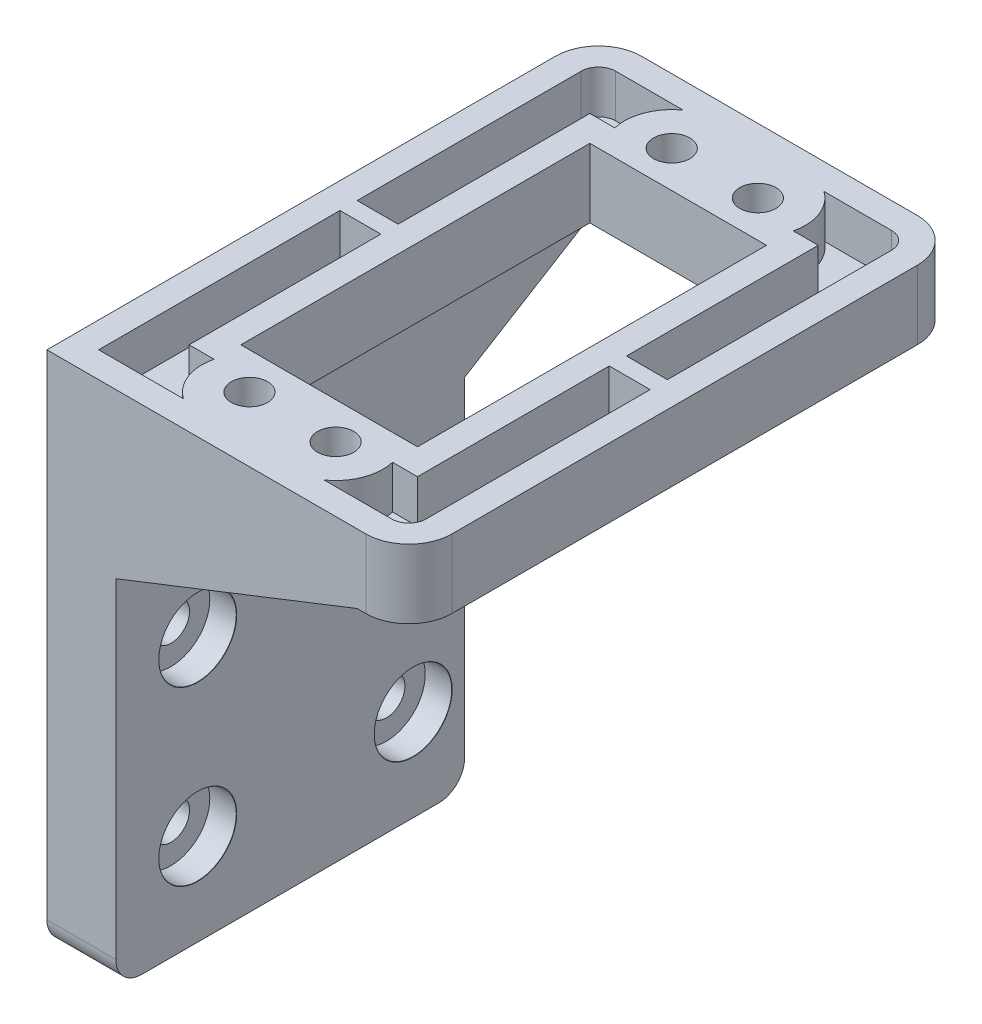
from build123d import *

# Parameters (mm, degrees)
SKETCH1_W                                     = 34.925
SKETCH1_H                                     = 49.276
BOSS_EXTRUDE1_DEPTH                           = 8
SKETCH2_W                                     = 42
SKETCH2_H                                     = 8
BOSS_EXTRUDE2_DEPTH                           = 34.925
CBORE_FOR_M4_PAN_HEAD_MACHINE_SCREW1_AT_COUNT = 2
CBORE_FOR_M4_PAN_HEAD_MACHINE_SCREW1_AT_PITCH = 25.000000038
CBORE_FOR_M4_PAN_HEAD_MACHINE_SCREW1_2_COUNT  = 2
CBORE_FOR_M4_PAN_HEAD_MACHINE_SCREW1_2_PITCH  = 32.015620982
CBORE_FOR_M4_PAN_HEAD_MACHINE_SCREW1_3_COUNT  = 2
CBORE_FOR_M4_PAN_HEAD_MACHINE_SCREW1_3_PITCH  = 19.999999624
SKETCH5_R                                     = 9
CUT_EXTRUDE1_DEPTH                            = 21
CUT_EXTRUDE2_START                            = -1
SKETCH5_4_R                                   = 11
CUT_EXTRUDE2_DEPTH                            = 7
FILLET1_R                                     = 17
SKETCH7_W                                     = 42
SKETCH7_H                                     = 64
BOSS_EXTRUDE3_DEPTH                           = 8
SKETCH8_R                                     = 2.5
CUT_EXTRUDE3_DEPTH                            = 252.336701124
MOVE_FACE1_OUTLINE_W                          = 8
MOVE_FACE1_OUTLINE_H                          = 4.5375
MOVE_FACE1_DEPTH                              = 41.276
SKETCH9_W                                     = 20.5
SKETCH9_H                                     = 40.5
CUT_EXTRUDE4_DEPTH                            = 250.891419084
MOVE_FACE2_BY                                 = 11
MOVE_START                                    = -24.5375
MOVE_FACE3_OUTLINE_W                          = 34
MOVE_FACE3_OUTLINE_H                          = 11
MOVE_FACE3_DEPTH                              = 64
MOVE_FACE3_2_OUTLINE_W                        = 8
MOVE_FACE3_2_OUTLINE_H                        = 11
MOVE_FACE3_2_DEPTH                            = 24.5375
FILLET2_R                                     = 5
SPLIT1_SURFACE_1_BACK                         = 98.433
SPLIT1_SURFACE_1_DEPTH                        = 196.866
SPLIT1_SURFACE_2_BACK                         = 98.433
SPLIT1_SURFACE_2_DEPTH                        = 196.866
SHELL2_START                                  = 55.276
SHELL2_DEPTH                                  = 5
SKETCH11_W                                    = 33.4625
SKETCH11_H                                    = 15.638000188
CUT_EXTRUDE5_DEPTH                            = 4
RIB1_REACH                                    = 85.394
SKETCH12_WALLS_W                              = 2
SKETCH12_WALLS_H                              = 184.425110988
MOVE_START_2                                  = 55.276
MOVE_FACE4_DEPTH                              = 5
RIB2_REACH                                    = 255.723
SKETCH13_WALLS_W                              = 514.195403297
SKETCH13_WALLS_H                              = 2
MOVE_FACE5_BY                                 = 1
FILLET3_R                                     = 3
RIB4_REACH                                    = 260.677
SKETCH14_WALL_W                               = 549.437720842
SKETCH14_WALL_H                               = 3
BOSS_EXTRUDE4_DEPTH                           = 8
MOVE_FACE6_BY                                 = 0.4
MOVE_FACE6_2_BY                               = 0.4
MOVE_FACE6_3_BY                               = 0.4
MOVE_FACE6_4_BY                               = 0.4


# Read off the part's stored shape, not the designer's step: Move Face1, Move Face3, Shell2, Move Face4
with BuildPart() as part:
    # Sketch1 → Boss-Extrude1 (new body)
    with BuildSketch(Plane(origin=(201.279107713, 0, 0), x_dir=(0, 0, -1), z_dir=(1, 0, 0))):
        with Locations((-17.4625, 24.638)):
            Rectangle(SKETCH1_W, SKETCH1_H)
    extrude(amount=BOSS_EXTRUDE1_DEPTH)

    # Sketch2 → Boss-Extrude2 (add)
    with BuildSketch(Plane(origin=(0, 0, 0), x_dir=(-1, 0, 0), z_dir=(0, 0, -1))):
        with Locations((-222.279107713, 45.276)):
            Rectangle(SKETCH2_W, SKETCH2_H)
    extrude(amount=-BOSS_EXTRUDE2_DEPTH)

    # Sketch3 → CBORE for M4 Pan Head Machine Screw1 (revolve, cut)
    with BuildSketch(Plane(origin=(209.279107713, 30.637999812, 4.962499981), x_dir=(0, 0, -1), z_dir=(0, 1, 0))):
        Polygon((0, 0), (0, 8), (2.15, 8), (2.15, 3.1), (4.5, 3.1), (4.5, 0.025), (4.525, 0), align=None)
    cbore_for_m4_pan_head_machine_screw1 = revolve(axis=Axis((215.629107713, 30.637999812, 4.962499981), (-1, 0, 0)), mode=Mode.SUBTRACT)

    # CBORE for M4 Pan Head Machine Screw1 at: CBORE for M4 Pan Head Machine Screw1 ×2
    with Locations(*[(0, 0, i * CBORE_FOR_M4_PAN_HEAD_MACHINE_SCREW1_AT_PITCH) for i in range(1, CBORE_FOR_M4_PAN_HEAD_MACHINE_SCREW1_AT_COUNT)]):
        add(cbore_for_m4_pan_head_machine_screw1, mode=Mode.SUBTRACT)

    # CBORE for M4 Pan Head Machine Screw1 2: CBORE for M4 Pan Head Machine Screw1 ×2
    with Locations(*[Vector(0, -0.624695039814301, 0.780868815635129) * (i * CBORE_FOR_M4_PAN_HEAD_MACHINE_SCREW1_2_PITCH) for i in range(1, CBORE_FOR_M4_PAN_HEAD_MACHINE_SCREW1_2_COUNT)]):
        add(cbore_for_m4_pan_head_machine_screw1, mode=Mode.SUBTRACT)

    # CBORE for M4 Pan Head Machine Screw1 3: CBORE for M4 Pan Head Machine Screw1 ×2
    with Locations(*[(0, -i * CBORE_FOR_M4_PAN_HEAD_MACHINE_SCREW1_3_PITCH, 0) for i in range(1, CBORE_FOR_M4_PAN_HEAD_MACHINE_SCREW1_3_COUNT)]):
        add(cbore_for_m4_pan_head_machine_screw1, mode=Mode.SUBTRACT)

    # Sketch5 → Cut-Extrude1 (cut)
    with BuildSketch(Plane(origin=(0, 49.276, 0), x_dir=(1, 0, 0), z_dir=(0, 1, 0))):
        with Locations(Location((222.279107713, -17.4625, 0), (0, 0, 180))):
            Circle(SKETCH5_R)
    extrude(amount=-CUT_EXTRUDE1_DEPTH, mode=Mode.SUBTRACT)

    # Sketch5<4> → Cut-Extrude2 (cut)
    with BuildSketch(Plane(origin=(0, 49.276, 0), x_dir=(1, 0, 0), z_dir=(0, 1, 0)).offset(CUT_EXTRUDE2_START)):
        with Locations(Location((222.279107713, -17.4625, 0), (0, 0, 180))):
            Circle(SKETCH5_4_R)
    extrude(amount=-CUT_EXTRUDE2_DEPTH, mode=Mode.SUBTRACT)

    # Fillet1
    fillet1_edges = [part.edges().sort_by_distance(p)[0] for p in [
        (243.279107713, 45.276, 34.925),
        (243.279107713, 45.276, 0),
    ]]
    fillet(fillet1_edges, radius=FILLET1_R)

    # Sketch7 → Boss-Extrude3 (add)
    with BuildSketch(Plane(origin=(0, 49.276, 0), x_dir=(1, 0, 0), z_dir=(0, 1, 0))):
        with Locations((222.279107713, -7.4625)):
            Rectangle(SKETCH7_W, SKETCH7_H)
    extrude(amount=-BOSS_EXTRUDE3_DEPTH)

    # Sketch8 → Cut-Extrude3 (cut, through all)
    with BuildSketch(Plane(origin=(0, 49.276, 0), x_dir=(1, 0, 0), z_dir=(0, 1, 0))):
        with Locations(Location((217.279107713, -31.9625, 0), (0, 0, 180))):
            Circle(SKETCH8_R)
        with Locations(Location((227.279107713, -31.9625, 0), (0, 0, 180))):
            Circle(SKETCH8_R)
        with Locations(Location((227.279107713, 17.0375, 0), (0, 0, 180))):
            Circle(SKETCH8_R)
        with Locations(Location((217.279107713, 17.0375, 0), (0, 0, 180))):
            Circle(SKETCH8_R)
    extrude(amount=-CUT_EXTRUDE3_DEPTH, mode=Mode.SUBTRACT)

    # Move Face1 outline → Move Face1 (add)
    with BuildSketch(Plane(origin=(0, 0, 0), x_dir=(1, 0, 0), z_dir=(0, 1, 0))):
        with Locations((205.279107713, -37.19375)):
            Rectangle(MOVE_FACE1_OUTLINE_W, MOVE_FACE1_OUTLINE_H)
    extrude(amount=MOVE_FACE1_DEPTH)

    # Sketch9 → Cut-Extrude4 (cut, through all)
    with BuildSketch(Plane.XZ.offset(-41.276)):
        with Locations((222.279107713, 7.4625)):
            Rectangle(SKETCH9_W, SKETCH9_H)
    extrude(amount=-CUT_EXTRUDE4_DEPTH, mode=Mode.SUBTRACT)

    # Move Face2: a face moved outward by 11.0
    extrude(part.faces().sort_by_distance((232.779107713, 49.276, 7.4625))[0], amount=MOVE_FACE2_BY, dir=(0, 1, 0))

    # Move Face3 outline → Move Face3 (cut)
    with BuildSketch(Plane.XY.offset(MOVE_START)):
        with Locations((226.279107713, 46.776)):
            Rectangle(MOVE_FACE3_OUTLINE_W, MOVE_FACE3_OUTLINE_H)
    extrude(amount=MOVE_FACE3_DEPTH, mode=Mode.SUBTRACT)

    # Move Face3 2 outline → Move Face3 2 (cut)
    with BuildSketch(Plane.XY.offset(MOVE_START)):
        with Locations((205.279107713, 46.776)):
            Rectangle(MOVE_FACE3_2_OUTLINE_W, MOVE_FACE3_2_OUTLINE_H)
    extrude(amount=MOVE_FACE3_2_DEPTH, mode=Mode.SUBTRACT)

    # Fillet2
    fillet2_edges = [part.edges().sort_by_distance(p)[0] for p in [
        (243.279107713, 56.276, 39.4625),
        (243.279107713, 56.276, -24.5375),
        (201.279107713, 56.276, -24.5375),
    ]]
    fillet(fillet2_edges, radius=FILLET2_R)


with BuildPart() as body_2:
    # Split1: the piece behind the surface
    add(part.part)
    # Split1 surface: a surface, the sketch's curves swept straight by 196.866 mm
    with BuildLine(Plane.ZY.offset(-201.279107713).offset(-SPLIT1_SURFACE_1_BACK), mode=Mode.PRIVATE) as split1_surface_1_path:
        Line((-9.008584857, 52.276), (46.481380633, 52.276))
    split1_surface_1 = Shell.extrude(split1_surface_1_path.wire(), (-1 * SPLIT1_SURFACE_1_DEPTH, 0 * SPLIT1_SURFACE_1_DEPTH, 0 * SPLIT1_SURFACE_1_DEPTH))
    split(bisect_by=split1_surface_1, keep=Keep.BOTTOM)


with BuildPart() as part_1:
    add(part.part)

    # Split1: split by a surface, the side it looks to stays
    # Split1 surface: a surface, the sketch's curves swept straight by 196.866 mm
    with BuildLine(Plane.ZY.offset(-201.279107713).offset(-SPLIT1_SURFACE_2_BACK), mode=Mode.PRIVATE) as split1_surface_2_path:
        Line((-9.008584857, 52.276), (46.481380633, 52.276))
    split1_surface_2 = Shell.extrude(split1_surface_2_path.wire(), (-1 * SPLIT1_SURFACE_2_DEPTH, 0 * SPLIT1_SURFACE_2_DEPTH, 0 * SPLIT1_SURFACE_2_DEPTH))
    split(bisect_by=split1_surface_2, keep=Keep.TOP)

    # Shell2 outline → Shell2 (cut)
    with BuildSketch(Plane(origin=(0, 0, 0), x_dir=(1, 0, 0), z_dir=(0, 1, 0)).offset(SHELL2_START)):
        with BuildLine():
            ThreePointArc((222.279107713, -34.253787847), (221.507026408, -35.480269678), (220.441385373, -36.4625))
            Line((220.441385373, -36.4625), (224.116830052, -36.4625))
            ThreePointArc((224.116830052, -36.4625), (223.051189017, -35.480269678), (222.279107713, -34.253787847))
        make_face()
        with BuildLine():
            ThreePointArc((232.635179034, -30.7125), (232.4178033, -33.923063097), (230.441385373, -36.4625))
            Line((230.441385373, -36.4625), (238.279107713, -36.4625))
            ThreePointArc((238.279107713, -36.4625), (239.693321275, -35.876713562), (240.279107713, -34.4625))
            Line((240.279107713, -34.4625), (240.279107713, 19.5375))
            ThreePointArc((240.279107713, 19.5375), (239.693321275, 20.951713562), (238.279107713, 21.5375))
            Line((238.279107713, 21.5375), (230.441385373, 21.5375))
            ThreePointArc((230.441385373, 21.5375), (232.4178033, 18.998063097), (232.635179034, 15.7875))
            Line((232.635179034, 15.7875), (235.529107713, 15.7875))
            Line((235.529107713, 15.7875), (235.529107713, -30.7125))
            Line((235.529107713, -30.7125), (232.635179034, -30.7125))
        make_face()
        with BuildLine():
            Line((204.279107713, 19.5375), (204.279107713, -36.4625))
            Line((204.279107713, -36.4625), (214.116830052, -36.4625))
            ThreePointArc((214.116830052, -36.4625), (212.140412125, -33.923063097), (211.923036391, -30.7125))
            Line((211.923036391, -30.7125), (209.029107713, -30.7125))
            Line((209.029107713, -30.7125), (209.029107713, 15.7875))
            Line((209.029107713, 15.7875), (211.923036391, 15.7875))
            ThreePointArc((211.923036391, 15.7875), (212.140412125, 18.998063097), (214.116830052, 21.5375))
            Line((214.116830052, 21.5375), (206.279107713, 21.5375))
            ThreePointArc((206.279107713, 21.5375), (204.86489415, 20.951713563), (204.279107713, 19.5375))
        make_face()
        with BuildLine():
            ThreePointArc((222.279107713, 19.328787847), (223.051189017, 20.555269678), (224.116830052, 21.5375))
            Line((224.116830052, 21.5375), (220.441385373, 21.5375))
            ThreePointArc((220.441385373, 21.5375), (221.507026408, 20.555269678), (222.279107713, 19.328787847))
        make_face()
    extrude(amount=SHELL2_DEPTH, mode=Mode.SUBTRACT)

    # Combine1: union body 2
    add(body_2.part)

    # Sketch11 → Cut-Extrude5 (cut)
    with BuildSketch(Plane.ZY.offset(-201.279107713)):
        with Locations((19.73125, 44.456999906)):
            Rectangle(SKETCH11_W, SKETCH11_H)
    extrude(amount=-CUT_EXTRUDE5_DEPTH, mode=Mode.SUBTRACT)

    # Sketch12 walls → Rib1 (add, up to next)
    with BuildSketch(Plane.ZY.offset(-201.279107713), mode=Mode.PRIVATE) as rib1_sk1:
        with Locations((19.73125, 44.456999906)):
            Rectangle(SKETCH12_WALLS_W, SKETCH12_WALLS_H)
    rib1_tool1 = extrude(rib1_sk1.sketch, amount=-RIB1_REACH, mode=Mode.PRIVATE) - part_1.part
    add(rib1_tool1.solids().sort_by_distance((201.279107713, 44.456999906, 19.73125))[0])

    # Move Face4 outline → Move Face4 (add)
    with BuildSketch(Plane(origin=(0, 0, 0), x_dir=(1, 0, 0), z_dir=(0, 1, 0)).offset(MOVE_START_2)):
        with BuildLine():
            ThreePointArc((222.279107713, -34.253787847), (221.507026408, -35.480269678), (220.441385373, -36.4625))
            Line((220.441385373, -36.4625), (224.116830052, -36.4625))
            ThreePointArc((224.116830052, -36.4625), (223.051189017, -35.480269678), (222.279107713, -34.253787847))
        make_face()
        with BuildLine():
            ThreePointArc((222.279107713, 19.328787847), (223.051189017, 20.555269678), (224.116830052, 21.5375))
            Line((224.116830052, 21.5375), (220.441385373, 21.5375))
            ThreePointArc((220.441385373, 21.5375), (221.507026408, 20.555269678), (222.279107713, 19.328787847))
        make_face()
    extrude(amount=MOVE_FACE4_DEPTH)

    # Sketch13 walls → Rib2 (add, up to next)
    with BuildSketch(Plane(origin=(0, 60.276, 0), x_dir=(1, 0, 0), z_dir=(0, 1, 0)), mode=Mode.PRIVATE) as rib2_sk1:
        with Locations((237.904107713, -7.4625)):
            Rectangle(SKETCH13_WALLS_W, SKETCH13_WALLS_H)
    rib2_tool1 = extrude(rib2_sk1.sketch, amount=-RIB2_REACH, mode=Mode.PRIVATE) - part_1.part
    # Sketch13 walls → Rib2 (add, up to next)
    with BuildSketch(Plane(origin=(0, 60.276, 0), x_dir=(1, 0, 0), z_dir=(0, 1, 0)), mode=Mode.PRIVATE) as rib2_sk2:
        with Locations((206.654107713, -7.4625)):
            Rectangle(SKETCH13_WALLS_W, SKETCH13_WALLS_H)
    rib2_tool2 = extrude(rib2_sk2.sketch, amount=-RIB2_REACH, mode=Mode.PRIVATE) - part_1.part
    add(rib2_tool1.solids().sort_by_distance((237.904107713, 60.276, 7.4625))[0])
    add(rib2_tool2.solids().sort_by_distance((206.654107713, 60.276, 7.4625))[0])

    # Move Face5: a face moved outward by 1.0
    extrude(part_1.faces().sort_by_distance((205.279107713, 26.138, 0))[0], amount=MOVE_FACE5_BY, dir=(0, 0, -1))

    # Fillet3
    fillet3_edges = [part_1.edges().sort_by_distance(p)[0] for p in [
        (205.279107713, 0, 39.4625),
        (205.279107713, 0, -1),
    ]]
    fillet(fillet3_edges, radius=FILLET3_R)

    # Sketch14 wall → Rib4 (add, up to next)
    with BuildSketch(Plane(origin=(223.279107713, 46.776, 39.4625), x_dir=(-0.93075149344, -0.365652372423, 0), z_dir=(0.365652372423, -0.93075149344, 0)), mode=Mode.PRIVATE) as rib4_sk1:
        with Locations((0, 1.5)):
            Rectangle(SKETCH14_WALL_W, SKETCH14_WALL_H)
    rib4_tool1 = extrude(rib4_sk1.sketch, amount=-RIB4_REACH, mode=Mode.PRIVATE) - part_1.part
    add(rib4_tool1.solids().sort_by_distance((223.279107713, 46.776, 39.4625))[0])

    # Sketch15 → Boss-Extrude4 (add)
    with BuildSketch(Plane.ZY.offset(-201.279107713)):
        Polygon((-19, 52.276), (-1, 41.276), (-1, 52.276), align=None)
    extrude(amount=-BOSS_EXTRUDE4_DEPTH)

    # Move Face6: a curved face moved outward by 0.4
    add(Solid.thicken(part_1.faces().sort_by_distance((229.779107713, 56.276, 31.9625))[0], MOVE_FACE6_BY))

    # Move Face6 2: a curved face moved outward by 0.4
    add(Solid.thicken(part_1.faces().sort_by_distance((219.779107713, 56.276, 31.9625))[0], MOVE_FACE6_2_BY))

    # Move Face6 3: a curved face moved outward by 0.4
    add(Solid.thicken(part_1.faces().sort_by_distance((229.779107713, 56.276, -17.0375))[0], MOVE_FACE6_3_BY))

    # Move Face6 4: a curved face moved outward by 0.4
    add(Solid.thicken(part_1.faces().sort_by_distance((219.779107713, 56.276, -17.0375))[0], MOVE_FACE6_4_BY))


solid = part_1.part
